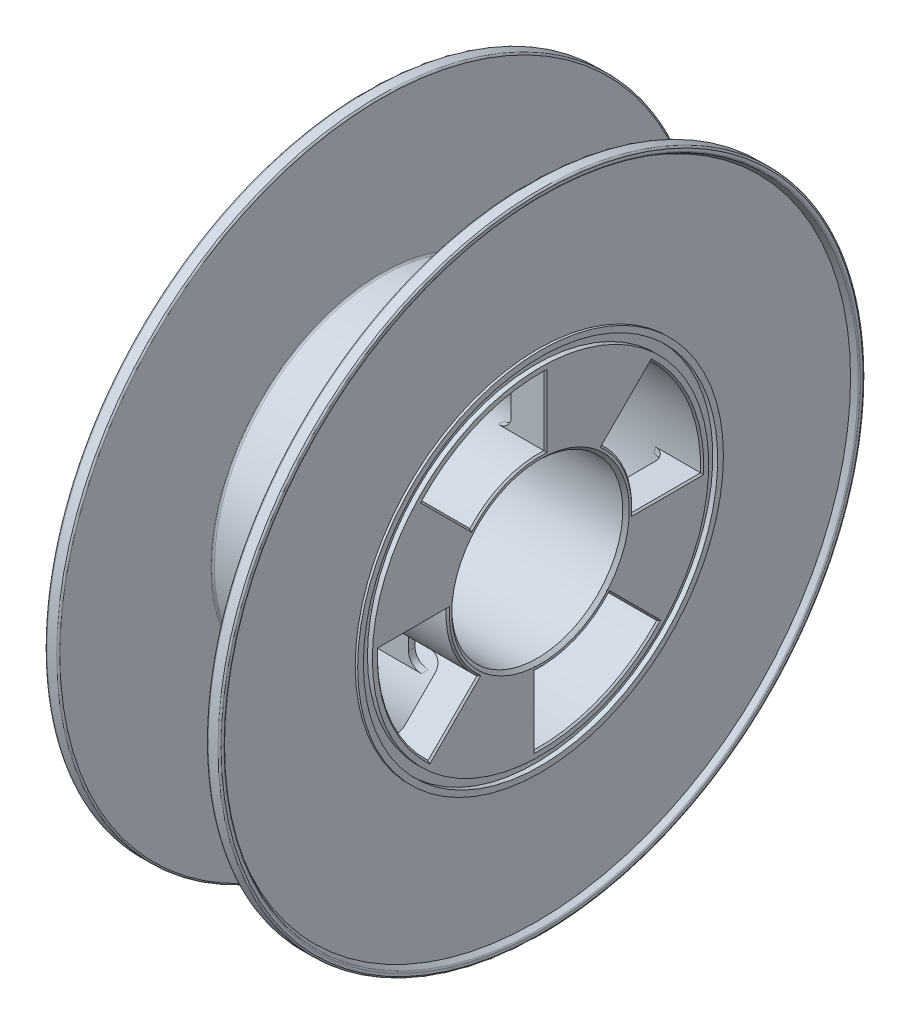
from build123d import *

# Parameters (mm, degrees)
FILLET1_R             = 0.5
SKETCH2_W             = 2
SKETCH2_H             = 23
EXTRUDE_THIN1_DEPTH   = 25
EXTRUDE_THIN1_2_DEPTH = 25
SKETCH5_W             = 2
SKETCH5_H             = 23
EXTRUDE_THIN2_DEPTH   = 25
EXTRUDE_THIN2_2_DEPTH = 25
CIRPATTERN1_COUNT     = 4
BOSS_EXTRUDE1_DEPTH   = 2
BOSS_EXTRUDE2_DEPTH   = 2
CHAMFER1_SIZE         = 0.5


with BuildPart() as part:
    # Sketch1 → Revolve1 (revolve)
    with BuildSketch(Plane.XY):
        Polygon((-25.25, 26.25), (25.25, 26.25), (26.25, 27.25), (26.25, 28.5), (-26.25, 28.5), (-26.25, 27.25), align=None)
        Polygon((-26.25, 49.625), (26.25, 49.625), (26.25, 51.625), (24.75, 51.625), (24.75, 54.375), (26.25, 54.375), (26.25, 56.125), (25.5, 56.125), (25, 96.4), (26.75, 97.4), (26.75, 99), (22.75, 99), (22.75, 51.625), (-22.75, 51.625), (-22.75, 99), (-26.75, 99), (-26.75, 97.4), (-25, 96.4), (-25.5, 56.125), (-26.25, 56.125), (-26.25, 54.375), (-24.75, 54.375), (-24.75, 51.625), (-26.25, 51.625), align=None)
    revolve(axis=Axis((0, 0, 0), (1, 0, 0)))

    # Fillet1
    fillet1_edges = [part.edges().sort_by_distance(p)[0] for p in [
        (-26.75, -97.4, 0),
        (-26.75, -99, 0),
        (26.75, -97.4, 0),
        (26.75, -99, 0),
        (22.75, -99, 0),
        (-22.75, -99, 0),
        (-22.75, -51.625, 0),
        (22.75, -51.625, 0),
    ]]
    fillet(fillet1_edges, radius=FILLET1_R)


with BuildPart() as body_2:
    # Sketch2 → Extrude-Thin1 (new body)
    with BuildSketch(Plane.ZY.offset(26.25)):
        with Locations((2.5, 38.635078773)):
            Rectangle(SKETCH2_W, SKETCH2_H)
    extrude(amount=-EXTRUDE_THIN1_DEPTH)


with BuildPart() as body_3:
    # Sketch2 → Extrude-Thin1 2 (new body)
    with BuildSketch(Plane.ZY.offset(26.25)):
        Polygon((18.126738036, 20.24805838), (34.390194004, 36.511514347), (32.975980441, 37.92572791), (16.712524474, 21.662271942), align=None)
    extrude(amount=-EXTRUDE_THIN1_2_DEPTH)


with BuildPart() as body_4:
    # Sketch5 → Extrude-Thin2 (new body)
    with BuildSketch(Plane(origin=(26.25, 0, 0), x_dir=(0, 0, -1), z_dir=(1, 0, 0))):
        with Locations((2.5, 38.635078773)):
            Rectangle(SKETCH5_W, SKETCH5_H)
    extrude(amount=-EXTRUDE_THIN2_DEPTH)


with BuildPart() as body_5:
    # Sketch5 → Extrude-Thin2 2 (new body)
    with BuildSketch(Plane(origin=(26.25, 0, 0), x_dir=(0, 0, -1), z_dir=(1, 0, 0))):
        Polygon((-37.92572791, 32.975980441), (-21.662271942, 16.712524474), (-20.24805838, 18.126738036), (-36.511514347, 34.390194004), align=None)
    extrude(amount=-EXTRUDE_THIN2_2_DEPTH)


with BuildPart() as cirpattern1_1:
    # CirPattern1: pattern copy
    add(body_4.part.rotate(Axis((0, 0, 0), (-1, 0, 0)), 1 * 360 / CIRPATTERN1_COUNT))


with BuildPart() as cirpattern1_2:
    # CirPattern1: pattern copy
    add(body_4.part.rotate(Axis((0, 0, 0), (-1, 0, 0)), 2 * 360 / CIRPATTERN1_COUNT))


with BuildPart() as cirpattern1_3:
    # CirPattern1: pattern copy
    add(body_4.part.rotate(Axis((0, 0, 0), (-1, 0, 0)), 3 * 360 / CIRPATTERN1_COUNT))


with BuildPart() as cirpattern1_4:
    # CirPattern1: pattern copy
    add(body_5.part.rotate(Axis((0, 0, 0), (-1, 0, 0)), 1 * 360 / CIRPATTERN1_COUNT))


with BuildPart() as cirpattern1_5:
    # CirPattern1: pattern copy
    add(body_5.part.rotate(Axis((0, 0, 0), (-1, 0, 0)), 2 * 360 / CIRPATTERN1_COUNT))


with BuildPart() as cirpattern1_6:
    # CirPattern1: pattern copy
    add(body_5.part.rotate(Axis((0, 0, 0), (-1, 0, 0)), 3 * 360 / CIRPATTERN1_COUNT))


with BuildPart() as cirpattern1_7:
    # CirPattern1: pattern copy
    add(body_2.part.rotate(Axis((0, 0, 0), (-1, 0, 0)), 1 * 360 / CIRPATTERN1_COUNT))


with BuildPart() as cirpattern1_8:
    # CirPattern1: pattern copy
    add(body_2.part.rotate(Axis((0, 0, 0), (-1, 0, 0)), 2 * 360 / CIRPATTERN1_COUNT))


with BuildPart() as cirpattern1_9:
    # CirPattern1: pattern copy
    add(body_2.part.rotate(Axis((0, 0, 0), (-1, 0, 0)), 3 * 360 / CIRPATTERN1_COUNT))


with BuildPart() as cirpattern1_10:
    # CirPattern1: pattern copy
    add(body_3.part.rotate(Axis((0, 0, 0), (-1, 0, 0)), 1 * 360 / CIRPATTERN1_COUNT))


with BuildPart() as cirpattern1_11:
    # CirPattern1: pattern copy
    add(body_3.part.rotate(Axis((0, 0, 0), (-1, 0, 0)), 2 * 360 / CIRPATTERN1_COUNT))


with BuildPart() as cirpattern1_12:
    # CirPattern1: pattern copy
    add(body_3.part.rotate(Axis((0, 0, 0), (-1, 0, 0)), 3 * 360 / CIRPATTERN1_COUNT))


with BuildPart() as cirpattern1_11_1:
    add(cirpattern1_11.part)

    # Combine1: union CirPattern1_8, CirPattern1_5, body 2, CirPattern1_2, part, body 3, CirPattern1_10, CirPattern1_7, body 4, CirPattern1_4, CirPattern1_1, body 5, CirPattern1_12, CirPattern1_9, CirPattern1_6, CirPattern1_3
    add(cirpattern1_8.part)
    add(cirpattern1_5.part)
    add(body_2.part)
    add(cirpattern1_2.part)
    add(part.part)
    add(body_3.part)
    add(cirpattern1_10.part)
    add(cirpattern1_7.part)
    add(body_4.part)
    add(cirpattern1_4.part)
    add(cirpattern1_1.part)
    add(body_5.part)
    add(cirpattern1_12.part)
    add(cirpattern1_9.part)
    add(cirpattern1_6.part)
    add(cirpattern1_3.part)

    # Sketch3 → Cut-Revolve1 (revolve, cut)
    with BuildSketch(Plane.XY):
        with BuildLine():
            Line((-11.75, 28.5), (11.75, 28.5))
            ThreePointArc((11.75, 28.5), (14.578427125, 29.671572875), (15.75, 32.5))
            Line((15.75, 32.5), (15.75, 45.625))
            ThreePointArc((15.75, 45.625), (14.578427125, 48.453427125), (11.75, 49.625))
            Line((11.75, 49.625), (-11.75, 49.625))
            ThreePointArc((-11.75, 49.625), (-14.578427125, 48.453427125), (-15.75, 45.625))
            Line((-15.75, 45.625), (-15.75, 32.5))
            ThreePointArc((-15.75, 32.5), (-14.578427125, 29.671572875), (-11.75, 28.5))
        make_face()
    revolve(axis=Axis((24.682987768, 0, 0), (-1, 0, 0)), mode=Mode.SUBTRACT)

    # Sketch4 → Boss-Extrude1 (add)
    with BuildSketch(Plane(origin=(26.25, 0, 0), x_dir=(0, 0, -1), z_dir=(1, 0, 0))):
        with BuildLine():
            Line((22.474873734, -17.525126266), (37.477663802, -32.527916333))
            ThreePointArc((37.477663802, -32.527916333), (45.847521801, -18.990665331), (49.501420434, -3.5))
            Line((49.501420434, -3.5), (28.284271247, -3.5))
            ThreePointArc((28.284271247, -3.5), (26.330566677, -10.906477822), (22.474873734, -17.525126266))
        make_face()
        with BuildLine():
            Line((3.5, 49.501420434), (3.5, 28.284271247))
            ThreePointArc((3.5, 28.284271247), (10.906477822, 26.330566677), (17.525126266, 22.474873734))
            Line((17.525126266, 22.474873734), (32.527916333, 37.477663802))
            ThreePointArc((32.527916333, 37.477663802), (18.990665331, 45.847521801), (3.5, 49.501420434))
        make_face()
        with BuildLine():
            Line((-22.474873734, 17.525126266), (-37.477663802, 32.527916333))
            ThreePointArc((-37.477663802, 32.527916333), (-45.847521801, 18.990665331), (-49.501420434, 3.5))
            Line((-49.501420434, 3.5), (-28.284271247, 3.5))
            ThreePointArc((-28.284271247, 3.5), (-26.330566677, 10.906477822), (-22.474873734, 17.525126266))
        make_face()
        with BuildLine():
            Line((-3.5, -49.501420434), (-3.5, -28.284271247))
            ThreePointArc((-3.5, -28.284271247), (-10.906477822, -26.330566677), (-17.525126266, -22.474873734))
            Line((-17.525126266, -22.474873734), (-32.527916333, -37.477663802))
            ThreePointArc((-32.527916333, -37.477663802), (-18.990665331, -45.847521801), (-3.5, -49.501420434))
        make_face()
    extrude(amount=-BOSS_EXTRUDE1_DEPTH)

    # Sketch6 → Boss-Extrude2 (add)
    with BuildSketch(Plane.ZY.offset(26.25)):
        with BuildLine():
            Line((22.474873734, -17.525126266), (37.477663802, -32.527916333))
            ThreePointArc((37.477663802, -32.527916333), (45.847521801, -18.990665331), (49.501420434, -3.5))
            Line((49.501420434, -3.5), (28.284271247, -3.5))
            ThreePointArc((28.284271247, -3.5), (26.330566677, -10.906477822), (22.474873734, -17.525126266))
        make_face()
        with BuildLine():
            Line((3.5, 49.501420434), (3.5, 28.284271247))
            ThreePointArc((3.5, 28.284271247), (10.906477822, 26.330566677), (17.525126266, 22.474873734))
            Line((17.525126266, 22.474873734), (32.527916333, 37.477663802))
            ThreePointArc((32.527916333, 37.477663802), (18.990665331, 45.847521801), (3.5, 49.501420434))
        make_face()
        with BuildLine():
            Line((-22.474873734, 17.525126266), (-37.477663802, 32.527916333))
            ThreePointArc((-37.477663802, 32.527916333), (-45.847521801, 18.990665331), (-49.501420434, 3.5))
            Line((-49.501420434, 3.5), (-28.284271247, 3.5))
            ThreePointArc((-28.284271247, 3.5), (-26.330566677, 10.906477822), (-22.474873734, 17.525126266))
        make_face()
        with BuildLine():
            Line((-17.525126266, -22.474873734), (-32.527916333, -37.477663802))
            ThreePointArc((-32.527916333, -37.477663802), (-18.990665331, -45.847521801), (-3.5, -49.501420434))
            Line((-3.5, -49.501420434), (-3.5, -28.284271247))
            ThreePointArc((-3.5, -28.284271247), (-10.906477822, -26.330566677), (-17.525126266, -22.474873734))
        make_face()
    extrude(amount=-BOSS_EXTRUDE2_DEPTH)

    # Chamfer1
    chamfer1_edges = [cirpattern1_11_1.edges().sort_by_distance(p)[0] for p in [
        (26.25, -28.660036183, 26.538715839),
        (26.25, -18.990665331, 45.847521801),
        (26.25, 1.5, 39.031411868),
        (26.25, -10.906477822, 26.330566677),
        (26.25, -45.847521801, -18.990665331),
        (26.25, -26.538715839, -28.660036183),
        (26.25, -26.330566677, -10.906477822),
        (26.25, -39.031411868, 1.5),
        (26.25, 18.990665331, -45.847521801),
        (26.25, -1.5, -39.031411868),
        (26.25, 10.906477822, -26.330566677),
        (26.25, 28.660036183, -26.538715839),
        (26.25, 26.034329465, 11.595847935),
        (26.25, 39.031411868, -1.5),
        (26.25, 26.538715839, 28.660036183),
        (26.25, 45.555238846, 19.681484667),
        (-26.25, -45.847521801, 18.990665331),
        (-26.25, -26.538715839, 28.660036183),
        (-26.25, -26.330566677, 10.906477822),
        (-26.25, -39.031411868, -1.5),
        (-26.25, 28.660036183, 26.538715839),
        (-26.25, 18.990665331, 45.847521801),
        (-26.25, -1.5, 39.031411868),
        (-26.25, 10.906477822, 26.330566677),
        (-26.25, 26.034329465, -11.595847935),
        (-26.25, 39.031411868, 1.5),
        (-26.25, 45.555238846, -19.681484667),
        (-26.25, 26.538715839, -28.660036183),
        (-26.25, 1.5, -39.031411868),
        (-26.25, -18.990665331, -45.847521801),
        (-26.25, -28.660036183, -26.538715839),
        (-26.25, -10.906477822, -26.330566677),
    ]]
    chamfer(chamfer1_edges, length=CHAMFER1_SIZE)


solid = cirpattern1_11_1.part
